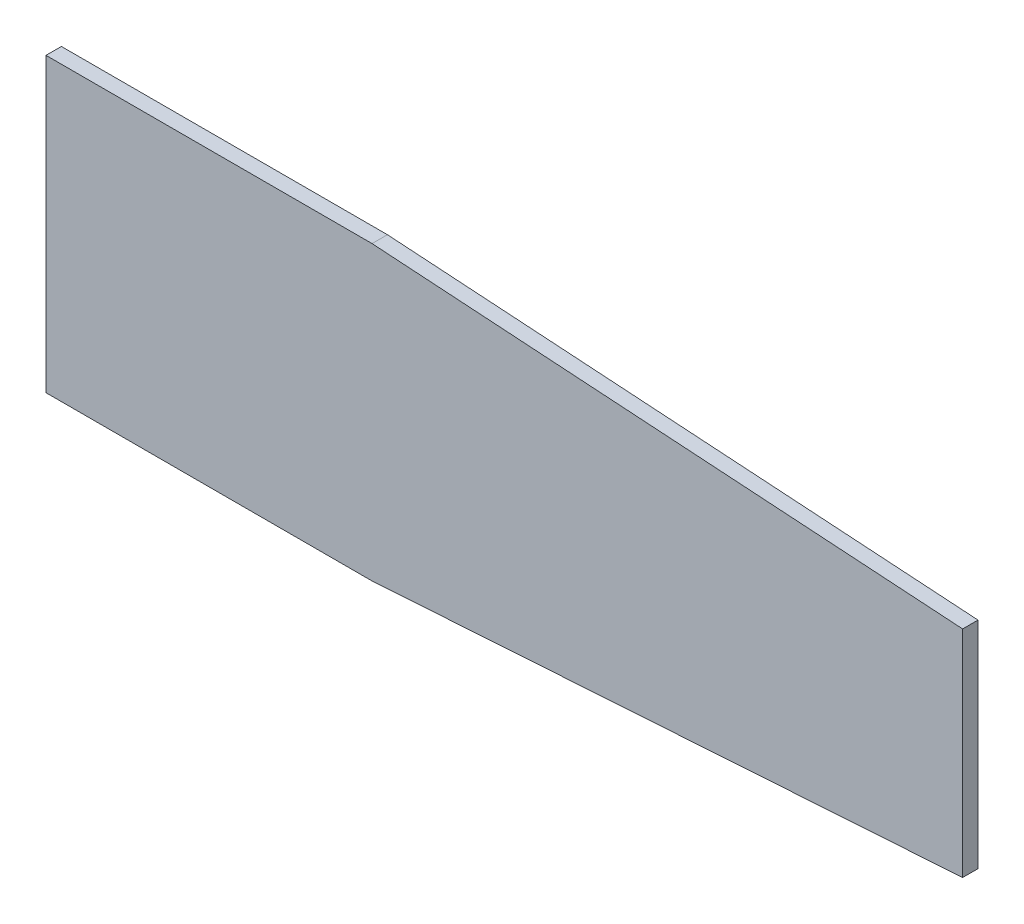
from build123d import *

# Parameters (mm, degrees)
GRUNDPLATTE_DEPTH = 5


with BuildPart() as part:
    # Skizze1 → Grundplatte (new body)
    with BuildSketch(Plane.XY):
        Polygon((0, -47.5), (0, 47.5), (106, 47.5), (298, 35), (298, -35), (106, -47.5), align=None)
    extrude(amount=GRUNDPLATTE_DEPTH)


solid = part.part
